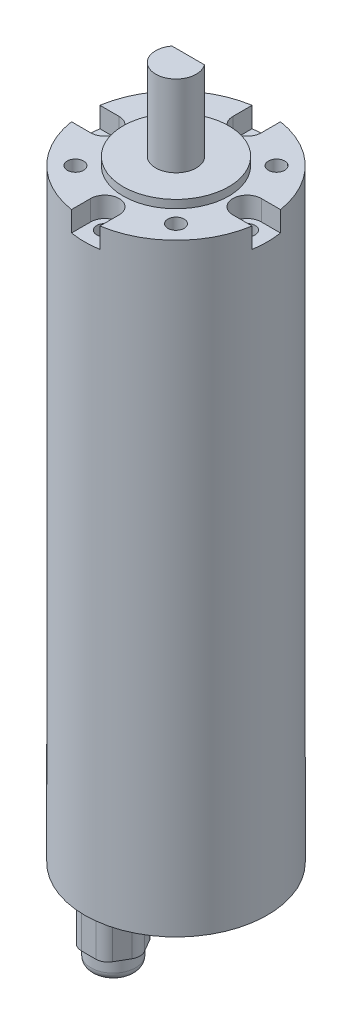
from build123d import *

# Parameters (mm, degrees)
SKETCH1_R           = 22.5
BOSS_EXTRUDE1_DEPTH = 78
SKETCH2_R           = 22.5
BOSS_EXTRUDE2_DEPTH = 70.5
SKETCH3_R           = 13
BOSS_EXTRUDE3_DEPTH = 2
BOSS_EXTRUDE4_DEPTH = 20
SKETCH5_R           = 5
BOSS_EXTRUDE5_DEPTH = 7
SKETCH6_R           = 2
CUT_EXTRUDE1_DEPTH  = 8
CUT_EXTRUDE2_START  = -5
CUT_EXTRUDE2_DEPTH  = 5
SKETCH8_R           = 2
CUT_EXTRUDE3_DEPTH  = 8
BOSS_EXTRUDE6_DEPTH = 9
SKETCH10_R          = 5.5
BOSS_EXTRUDE7_DEPTH = 5
FILLET1_R           = 3
FILLET2_R           = 2
SKETCH11_R          = 5.5
BOSS_EXTRUDE8_DEPTH = 1
FILLET3_R           = 1


with BuildPart() as part:
    # Sketch1 → Boss-Extrude1 (new body)
    with BuildSketch(Plane(origin=(0, 0, 0), x_dir=(1, 0, 0), z_dir=(0, 1, 0))):
        with Locations(Location((0, 0, 0), (0, 0, 270))):
            Circle(SKETCH1_R)
    extrude(amount=BOSS_EXTRUDE1_DEPTH)

    # Sketch2 → Boss-Extrude2 (add)
    with BuildSketch(Plane(origin=(0, 78, 0), x_dir=(1, 0, 0), z_dir=(0, 1, 0))):
        with Locations(Location((0, 0, 0), (0, 0, 270))):
            Circle(SKETCH2_R)
    extrude(amount=BOSS_EXTRUDE2_DEPTH)

    # Sketch3 → Boss-Extrude3 (add)
    with BuildSketch(Plane(origin=(0, 148.5, 0), x_dir=(1, 0, 0), z_dir=(0, 1, 0))):
        with Locations(Location((0, 0, 0), (0, 0, 270))):
            Circle(SKETCH3_R)
    extrude(amount=BOSS_EXTRUDE3_DEPTH)

    # Sketch4 → Boss-Extrude4 (add)
    with BuildSketch(Plane(origin=(0, 150.5, 0), x_dir=(1, 0, 0), z_dir=(0, 1, 0))):
        with BuildLine():
            ThreePointArc((-4, 3), (-4.472135955, -2.236067977), (0, -5))
            Line((0, -5), (0, 3))
            Line((0, 3), (-4, 3))
        make_face()
        with BuildLine():
            Line((0, 3), (0, -5))
            ThreePointArc((0, -5), (3.535533906, -3.535533906), (5, 0))
            ThreePointArc((5, 0), (4.74341649, 1.58113883), (4, 3))
            Line((4, 3), (0, 3))
        make_face()
    extrude(amount=BOSS_EXTRUDE4_DEPTH)

    # Sketch5 → Boss-Extrude5 (add)
    with BuildSketch(Plane(origin=(0, 150.5, 0), x_dir=(1, 0, 0), z_dir=(0, 1, 0))):
        with Locations(Location((0, 0, 0), (0, 0, 143.130102354))):
            Circle(SKETCH5_R)
    extrude(amount=BOSS_EXTRUDE5_DEPTH)

    # Sketch6 → Cut-Extrude1 (cut)
    with BuildSketch(Plane(origin=(0, 148.5, 0), x_dir=(1, 0, 0), z_dir=(0, 1, 0))):
        with Locations(Location((-12.374368671, 12.374368671, 0), (0, 0, 270))):
            Circle(SKETCH6_R)
        with Locations(Location((12.374368671, 12.374368671, 0), (0, 0, 270))):
            Circle(SKETCH6_R)
        with Locations(Location((12.374368671, -12.374368671, 0), (0, 0, 270))):
            Circle(SKETCH6_R)
        with Locations(Location((-12.374368671, -12.374368671, 0), (0, 0, 270))):
            Circle(SKETCH6_R)
    extrude(amount=-CUT_EXTRUDE1_DEPTH, mode=Mode.SUBTRACT)

    # Sketch7 → Cut-Extrude2 (cut)
    with BuildSketch(Plane(origin=(0, 148.5, 0), x_dir=(1, 0, 0), z_dir=(0, 1, 0)).offset(CUT_EXTRUDE2_START)):
        with BuildLine():
            ThreePointArc((22.5, 0), (22.431423187, 1.755350058), (22.226110771, 3.5))
            Line((22.226110771, 3.5), (17.5, 3.5))
            ThreePointArc((17.5, 3.5), (19.974873734, 2.474873734), (21, 0))
            ThreePointArc((21, 0), (19.974873734, -2.474873734), (17.5, -3.5))
            Line((17.5, -3.5), (22.226110771, -3.5))
            ThreePointArc((22.226110771, -3.5), (22.431423187, -1.755350058), (22.5, 0))
        make_face()
        with BuildLine():
            ThreePointArc((21, 0), (19.974873734, 2.474873734), (17.5, 3.5))
            Line((17.5, 3.5), (17.5, -3.5))
            ThreePointArc((17.5, -3.5), (19.974873734, -2.474873734), (21, 0))
        make_face()
        with BuildLine():
            Line((17.5, -3.5), (17.5, 3.5))
            ThreePointArc((17.5, 3.5), (14, 0), (17.5, -3.5))
        make_face()
        with BuildLine():
            ThreePointArc((3.5, 22.226110771), (1.755350006, 22.431423191), (-1.05e-07, 22.5))
            ThreePointArc((-1.05e-07, 22.5), (-1.755350111, 22.431423182), (-3.5, 22.226110771))
            Line((-3.5, 22.226110771), (-3.5, 17.5))
            ThreePointArc((-3.5, 17.5), (0, 21), (3.5, 17.5))
            Line((3.5, 17.5), (3.5, 22.226110771))
        make_face()
        with BuildLine():
            ThreePointArc((3.5, 17.5), (0, 21), (-3.5, 17.5))
            Line((-3.5, 17.5), (3.5, 17.5))
        make_face()
        with BuildLine():
            Line((3.5, 17.5), (-3.5, 17.5))
            ThreePointArc((-3.5, 17.5), (0, 14), (3.5, 17.5))
        make_face()
        with BuildLine():
            ThreePointArc((-14, 0), (-15.025126266, 2.474873734), (-17.5, 3.5))
            Line((-17.5, 3.5), (-17.5, -3.5))
            ThreePointArc((-17.5, -3.5), (-15.025126266, -2.474873734), (-14, 0))
        make_face()
        with BuildLine():
            Line((-17.5, -3.5), (-17.5, 3.5))
            ThreePointArc((-17.5, 3.5), (-21, 0), (-17.5, -3.5))
        make_face()
        with BuildLine():
            Line((-17.5, 3.5), (-22.226110771, 3.5))
            ThreePointArc((-22.226110771, 3.5), (-22.431423191, 1.755350006), (-22.5, -1.05e-07))
            ThreePointArc((-22.5, -1.05e-07), (-22.431423182, -1.755350111), (-22.226110771, -3.5))
            Line((-22.226110771, -3.5), (-17.5, -3.5))
            ThreePointArc((-17.5, -3.5), (-21, 0), (-17.5, 3.5))
        make_face()
        with BuildLine():
            ThreePointArc((3.5, -17.5), (0, -14), (-3.5, -17.5))
            Line((-3.5, -17.5), (3.5, -17.5))
        make_face()
        with BuildLine():
            Line((3.5, -17.5), (-3.5, -17.5))
            ThreePointArc((-3.5, -17.5), (0, -21), (3.5, -17.5))
        make_face()
        with BuildLine():
            Line((-3.5, -17.5), (-3.5, -22.226110771))
            ThreePointArc((-3.5, -22.226110771), (-1.755350006, -22.431423191), (1.05e-07, -22.5))
            ThreePointArc((1.05e-07, -22.5), (1.755350111, -22.431423182), (3.5, -22.226110771))
            Line((3.5, -22.226110771), (3.5, -17.5))
            ThreePointArc((3.5, -17.5), (0, -21), (-3.5, -17.5))
        make_face()
    extrude(amount=CUT_EXTRUDE2_DEPTH, mode=Mode.SUBTRACT)

    # Sketch8 → Cut-Extrude3 (cut)
    with BuildSketch(Plane(origin=(0, 143.5, 0), x_dir=(1, 0, 0), z_dir=(0, 1, 0))):
        with Locations(Location((0, 17.5, 0), (0, 0, 270))):
            Circle(SKETCH8_R)
        with Locations(Location((17.5, 0, 0), (0, 0, 270))):
            Circle(SKETCH8_R)
        with Locations(Location((0, -17.5, 0), (0, 0, 270))):
            Circle(SKETCH8_R)
        with Locations(Location((-17.5, 0, 0), (0, 0, 270))):
            Circle(SKETCH8_R)
    extrude(amount=-CUT_EXTRUDE3_DEPTH, mode=Mode.SUBTRACT)

    # Sketch9 → Boss-Extrude6 (add)
    with BuildSketch(Plane.XZ):
        Polygon((-3.5, 21.5), (3.5, 21.5), (7, 15.437822174), (3.5, 9.375644347), (-3.5, 9.375644347), (-7, 15.437822174), align=None)
    extrude(amount=BOSS_EXTRUDE6_DEPTH)

    # Sketch10 → Boss-Extrude7 (add)
    with BuildSketch(Plane.XZ.offset(9)):
        with Locations(Location((0, 15.437822174, 0), (0, 0, 270))):
            Circle(SKETCH10_R)
    extrude(amount=BOSS_EXTRUDE7_DEPTH)

    # Fillet1
    fillet1_edges = [part.edges().sort_by_distance(p)[0] for p in [
        (-3.5, -4.5, 21.5),
        (-7, -4.5, 15.437822174),
        (-3.5, -4.5, 9.375644347),
        (3.5, -4.5, 9.375644347),
        (7, -4.5, 15.437822174),
        (3.5, -4.5, 21.5),
    ]]
    fillet(fillet1_edges, radius=FILLET1_R)

    # Fillet2
    fillet2_edges = [part.edges().sort_by_distance(p)[0] for p in [
        (0, -14, 20.937822174),
    ]]
    fillet(fillet2_edges, radius=FILLET2_R)

    # Sketch11 → Boss-Extrude8 (add)
    with BuildSketch(Plane.XZ):
        with Locations(Location((0, 0, 0), (0, 0, 90))):
            Circle(SKETCH11_R)
    extrude(amount=BOSS_EXTRUDE8_DEPTH)

    # Fillet3
    fillet3_edges = [part.edges().sort_by_distance(p)[0] for p in [
        (0, -1, -5.5),
    ]]
    fillet(fillet3_edges, radius=FILLET3_R - 0.0001)  # a hair under: the kernel refuses the full size


solid = part.part
